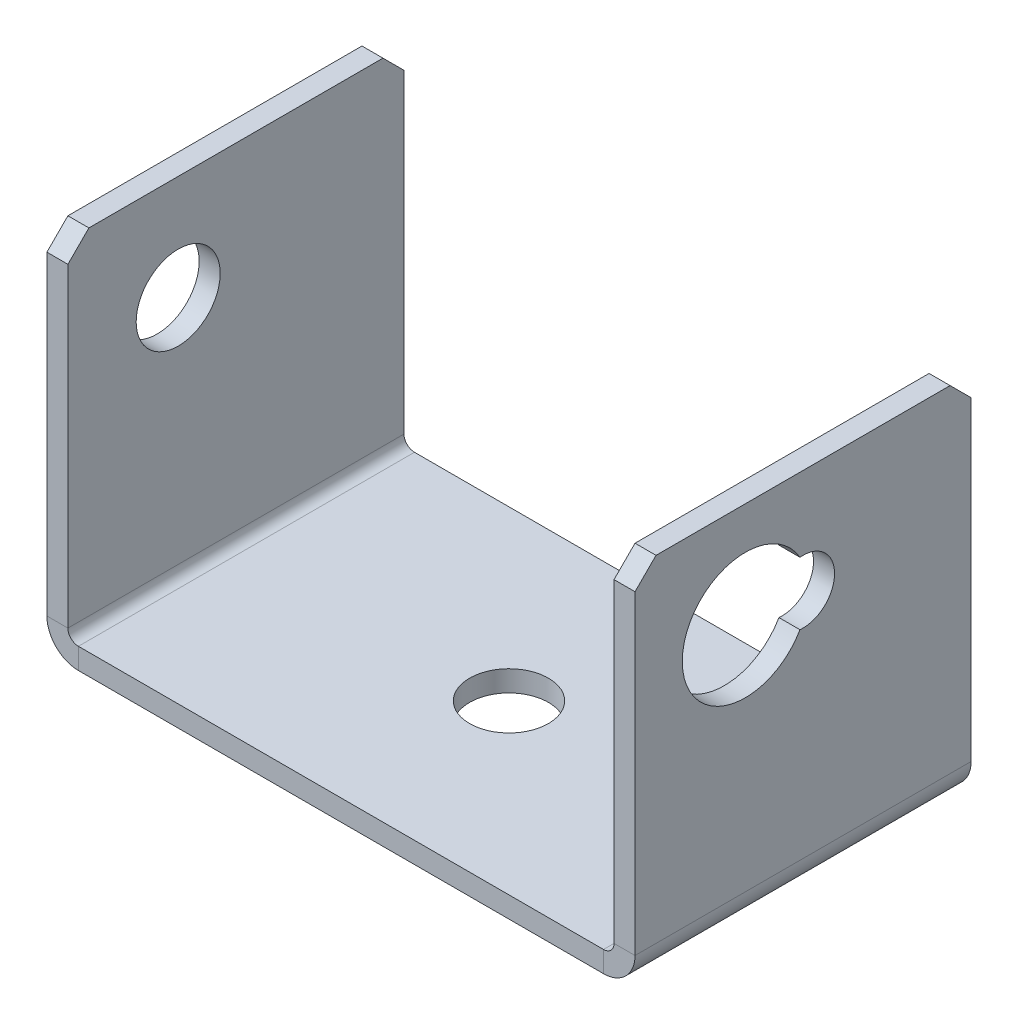
from build123d import *

# Parameters (mm, degrees)
BASE_FLANGE1_DEPTH = 32
CUT_EXTRUDE1_DEPTH = 10
SKETCH7_R          = 4
CUT_EXTRUDE2_DEPTH = 10
SKETCH8_R          = 3.75
CUT_EXTRUDE4_DEPTH = 10
CHAMFER1_SIZE      = 2


# Read off the part's stored shape, not the designer's step: Base-Flange1
with BuildPart() as part:
    # Base-Flange1 outline → Base-Flange1 (new body)
    with BuildSketch(Plane.XY):
        with BuildLine():
            Line((56, 3), (56, 35))
            Line((56, 35), (54, 35))
            Line((54, 35), (54, 3))
            ThreePointArc((54, 3), (53.707106781, 2.292893219), (53, 2))
            Line((53, 2), (3, 2))
            ThreePointArc((3, 2), (2.292893219, 2.292893219), (2, 3))
            Line((2, 3), (2, 35))
            Line((2, 35), (0, 35))
            Line((0, 35), (0, 3))
            ThreePointArc((0, 3), (0.878679656, 0.878679656), (3, 0))
            Line((3, 0), (53, 0))
            ThreePointArc((53, 0), (55.121320344, 0.878679656), (56, 3))
        make_face()
    extrude(amount=BASE_FLANGE1_DEPTH)

    # Sketch6 → Cut-Extrude1 (cut)
    with BuildSketch(Plane(origin=(56, 0, 0), x_dir=(0, 0, -1), z_dir=(1, 0, 0))):
        with BuildLine():
            ThreePointArc((-16.295454545, 27.985415651), (-27.5, 25), (-16.295454545, 22.014584349))
            ThreePointArc((-16.295454545, 22.014584349), (-13, 25), (-16.295454545, 27.985415651))
        make_face()
    extrude(amount=-CUT_EXTRUDE1_DEPTH, mode=Mode.SUBTRACT)

    # Sketch7 → Cut-Extrude2 (cut)
    with BuildSketch(Plane.ZY):
        with Locations((21.5, 25)):
            Circle(SKETCH7_R)
    extrude(amount=-CUT_EXTRUDE2_DEPTH, mode=Mode.SUBTRACT)

    # Sketch8 → Cut-Extrude4 (cut)
    with BuildSketch(Plane(origin=(0, 2, 0), x_dir=(1, 0, 0), z_dir=(0, 1, 0))):
        with Locations(Location((28, -16, 0), (0, 0, 270))):
            Circle(SKETCH8_R)
    extrude(amount=-CUT_EXTRUDE4_DEPTH, mode=Mode.SUBTRACT)

    # Chamfer1
    chamfer1_edges = [part.edges().sort_by_distance(p)[0] for p in [
        (1, 35, 0),
        (55, 35, 0),
        (1, 35, 32),
        (55, 35, 32),
    ]]
    chamfer(chamfer1_edges, length=CHAMFER1_SIZE)


solid = part.part
